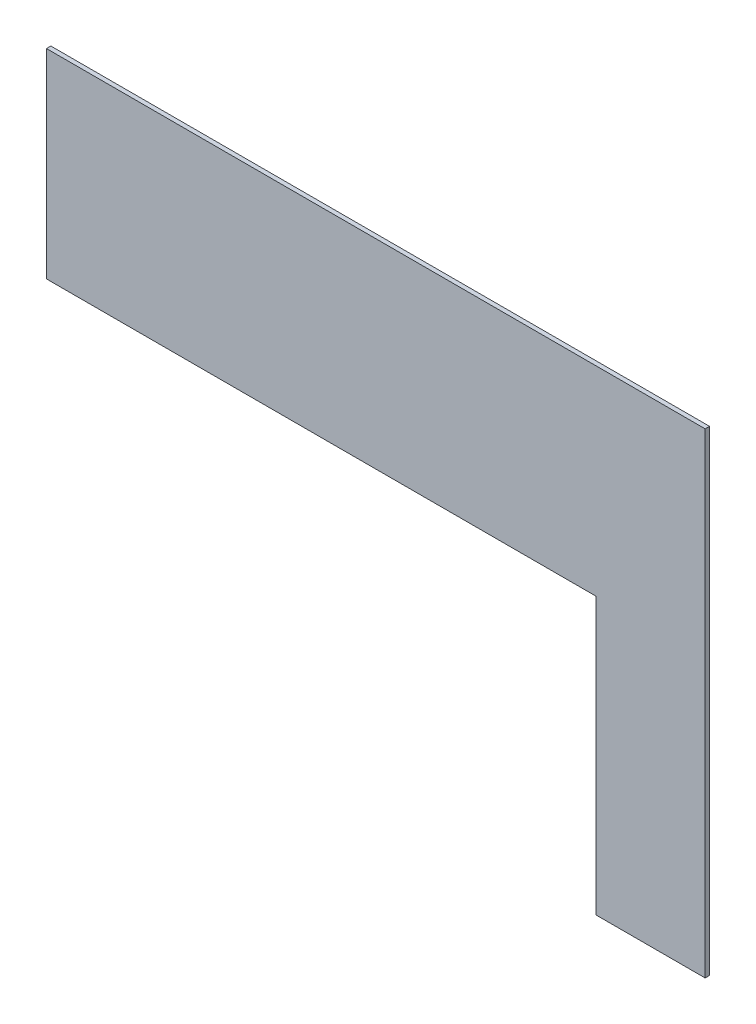
from build123d import *

# Parameters (mm, degrees)
TABAN_FLAN_1_DEPTH = 8


# Sheet-metal steps are written as plain solids
with BuildPart() as part:
    # Çizim1 → Taban-Flanş1 (new body)
    with BuildSketch(Plane.XY):
        Polygon((0, 0), (1205, 0), (1205, -870), (1005, -870), (1005, -365), (0, -365), align=None)
    extrude(amount=-TABAN_FLAN_1_DEPTH)


solid = part.part
